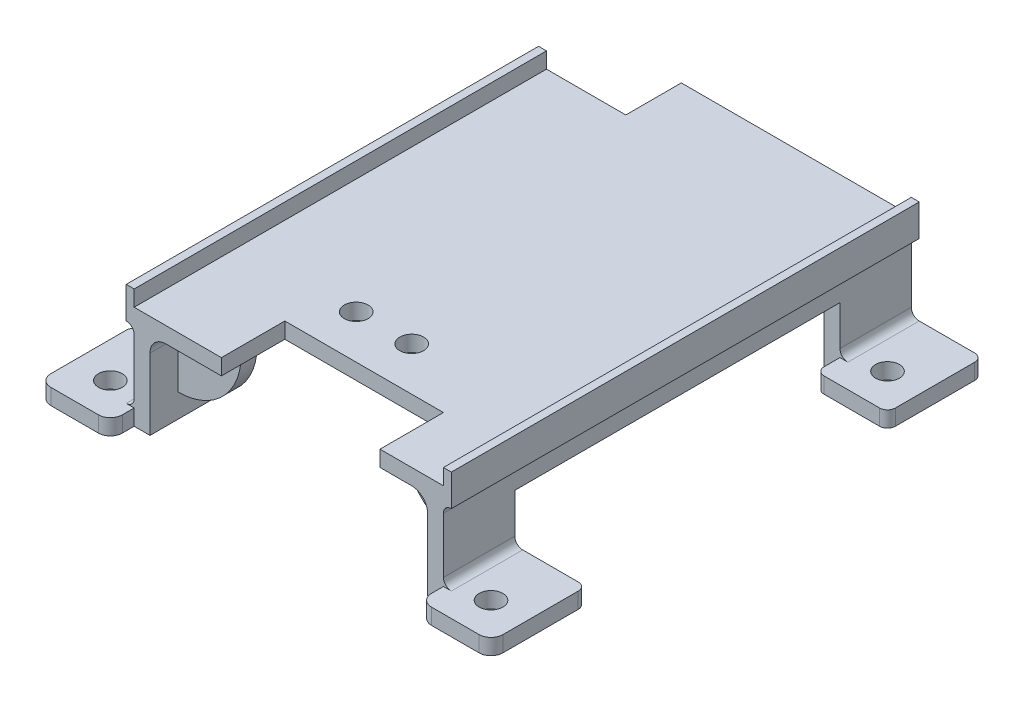
from build123d import *

# Parameters (mm, degrees)
SKETCH1_W           = 57
SKETCH1_H           = 59
BOSS_EXTRUDE1_DEPTH = 13
SKETCH2_W           = 41
SKETCH2_H           = 13
CUT_EXTRUDE1_DEPTH  = 9
SKETCH4_W           = 10
SKETCH4_H           = 7
CUT_EXTRUDE3_DEPTH  = 84.060219118
SKETCH5_W           = 34
SKETCH5_H           = 13
CUT_EXTRUDE4_DEPTH  = 9
SKETCH8_W           = 20
SKETCH8_H           = 13
CUT_EXTRUDE5_DEPTH  = 8
SKETCH9_W           = 35
SKETCH9_H           = 59
CUT_EXTRUDE6_DEPTH  = 11
SKETCH10_W          = 9
SKETCH10_H          = 7
CUT_EXTRUDE7_DEPTH  = 84.060219118
SKETCH11_W          = 9
SKETCH11_H          = 9
CUT_EXTRUDE8_DEPTH  = 11
SKETCH12_W          = 9
SKETCH12_H          = 9
CUT_EXTRUDE9_DEPTH  = 11
SKETCH13_W          = 9
SKETCH13_H          = 9
CUT_EXTRUDE10_DEPTH = 11
SKETCH14_W          = 9
SKETCH14_H          = 9
CUT_EXTRUDE11_DEPTH = 11
SKETCH15_W          = 2
SKETCH15_H          = 41
CUT_EXTRUDE12_DEPTH = 8
SKETCH16_W          = 2
SKETCH16_H          = 34
CUT_EXTRUDE13_DEPTH = 8
SKETCH31_W          = 2
SKETCH31_H          = 8
REVOLVE3_ANGLE      = 90
SKETCH32_W          = 2
SKETCH32_H          = 8
REVOLVE4_ANGLE      = 90
SKETCH33_W          = 6
SKETCH33_H          = 2
REVOLVE5_ANGLE      = 90
SKETCH34_W          = 2
SKETCH34_H          = 8
REVOLVE6_ANGLE      = 90
SKETCH42_R          = 1.5
CUT_EXTRUDE15_DEPTH = 84.060219118
SKETCH46_W          = 59
SKETCH46_H          = 2
BOSS_EXTRUDE3_DEPTH = 1
SKETCH47_W          = 1
SKETCH47_H          = 59
BOSS_EXTRUDE4_DEPTH = 2
SKETCH48_W          = 52
SKETCH48_H          = 2
BOSS_EXTRUDE5_DEPTH = 1
SKETCH49_W          = 1
SKETCH49_H          = 52
BOSS_EXTRUDE6_DEPTH = 2
SKETCH50_W          = 9
SKETCH50_H          = 2
BOSS_EXTRUDE7_DEPTH = 3
SKETCH51_W          = 9
SKETCH51_H          = 2
BOSS_EXTRUDE8_DEPTH = 3
SKETCH52_W          = 9
SKETCH52_H          = 2
BOSS_EXTRUDE9_DEPTH = 3
SKETCH53_R          = 1.5
CUT_EXTRUDE16_DEPTH = 84.060219118
FILLET2_R           = 1.5
FILLET3_R           = 1
FILLET6_START       = -1
FILLET6_DEPTH       = 9
FILLET7_START       = -9
FILLET7_DEPTH       = 9
FILLET7_START_2     = -59
FILLET7_2_DEPTH     = 9
FILLET7_START_3     = -52
FILLET7_3_DEPTH     = 9
FILLET8_START       = -52
FILLET8_DEPTH       = 52
FILLET8_START_2     = -59
FILLET8_2_DEPTH     = 7


with BuildPart() as part:
    # Sketch1 → Boss-Extrude1 (new body)
    with BuildSketch(Plane(origin=(0, 0, 0), x_dir=(1, 0, 0), z_dir=(0, 1, 0))):
        with Locations((28.5, 29.5)):
            Rectangle(SKETCH1_W, SKETCH1_H)
    extrude(amount=BOSS_EXTRUDE1_DEPTH)

    # Sketch2 → Cut-Extrude1 (cut)
    with BuildSketch(Plane(origin=(57, 0, 0), x_dir=(0, 0, -1), z_dir=(1, 0, 0))):
        with Locations((29.5, 6.5)):
            Rectangle(SKETCH2_W, SKETCH2_H)
    extrude(amount=-CUT_EXTRUDE1_DEPTH, mode=Mode.SUBTRACT)

    # Sketch4 → Cut-Extrude3 (cut, through all)
    with BuildSketch(Plane(origin=(0, 13, 0), x_dir=(1, 0, 0), z_dir=(0, 1, 0))):
        with Locations((5, 55.5)):
            Rectangle(SKETCH4_W, SKETCH4_H)
    extrude(amount=-CUT_EXTRUDE3_DEPTH, mode=Mode.SUBTRACT)

    # Sketch5 → Cut-Extrude4 (cut)
    with BuildSketch(Plane.ZY):
        with Locations((-26, 6.5)):
            Rectangle(SKETCH5_W, SKETCH5_H)
    extrude(amount=-CUT_EXTRUDE4_DEPTH, mode=Mode.SUBTRACT)

    # Sketch8 → Cut-Extrude5 (cut)
    with BuildSketch(Plane.XY):
        with Locations((30, 6.5)):
            Rectangle(SKETCH8_W, SKETCH8_H)
    extrude(amount=-CUT_EXTRUDE5_DEPTH, mode=Mode.SUBTRACT)

    # Sketch9 → Cut-Extrude6 (cut)
    with BuildSketch(Plane(origin=(0, 0, 0), x_dir=(-1, 0, 0), z_dir=(0, -1, 0))):
        with Locations((-28.5, 29.5)):
            Rectangle(SKETCH9_W, SKETCH9_H)
    extrude(amount=-CUT_EXTRUDE6_DEPTH, mode=Mode.SUBTRACT)

    # Sketch10 → Cut-Extrude7 (cut, through all)
    with BuildSketch(Plane(origin=(0, 13, 0), x_dir=(1, 0, 0), z_dir=(0, 1, 0))):
        with Locations((14.5, 55.5)):
            Rectangle(SKETCH10_W, SKETCH10_H)
    extrude(amount=-CUT_EXTRUDE7_DEPTH, mode=Mode.SUBTRACT)

    # Sketch11 → Cut-Extrude8 (cut)
    with BuildSketch(Plane(origin=(0, 13, 0), x_dir=(1, 0, 0), z_dir=(0, 1, 0))):
        with Locations((52.5, 4.5)):
            Rectangle(SKETCH11_W, SKETCH11_H)
    extrude(amount=-CUT_EXTRUDE8_DEPTH, mode=Mode.SUBTRACT)

    # Sketch12 → Cut-Extrude9 (cut)
    with BuildSketch(Plane(origin=(0, 13, 0), x_dir=(1, 0, 0), z_dir=(0, 1, 0))):
        with Locations((52.5, 54.5)):
            Rectangle(SKETCH12_W, SKETCH12_H)
    extrude(amount=-CUT_EXTRUDE9_DEPTH, mode=Mode.SUBTRACT)

    # Sketch13 → Cut-Extrude10 (cut)
    with BuildSketch(Plane(origin=(0, 13, 0), x_dir=(1, 0, 0), z_dir=(0, 1, 0))):
        with Locations((4.5, 47.5)):
            Rectangle(SKETCH13_W, SKETCH13_H)
    extrude(amount=-CUT_EXTRUDE10_DEPTH, mode=Mode.SUBTRACT)

    # Sketch14 → Cut-Extrude11 (cut)
    with BuildSketch(Plane(origin=(0, 13, 0), x_dir=(1, 0, 0), z_dir=(0, 1, 0))):
        with Locations((4.5, 4.5)):
            Rectangle(SKETCH14_W, SKETCH14_H)
    extrude(amount=-CUT_EXTRUDE11_DEPTH, mode=Mode.SUBTRACT)

    # Sketch15 → Cut-Extrude12 (cut)
    with BuildSketch(Plane(origin=(0, 0, 0), x_dir=(-1, 0, 0), z_dir=(0, -1, 0))):
        with Locations((-47, 29.5)):
            Rectangle(SKETCH15_W, SKETCH15_H)
    extrude(amount=-CUT_EXTRUDE12_DEPTH, mode=Mode.SUBTRACT)

    # Sketch16 → Cut-Extrude13 (cut)
    with BuildSketch(Plane(origin=(0, 0, 0), x_dir=(-1, 0, 0), z_dir=(0, -1, 0))):
        with Locations((-10, 26)):
            Rectangle(SKETCH16_W, SKETCH16_H)
    extrude(amount=-CUT_EXTRUDE13_DEPTH, mode=Mode.SUBTRACT)

    # Sketch31 → Revolve3 (revolve)
    with BuildSketch(Plane(origin=(11, 0, 0), x_dir=(0, 0, -1), z_dir=(1, 0, 0))):
        with Locations((4.5, 7)):
            Rectangle(SKETCH31_W, SKETCH31_H)
    revolve(axis=Axis((11, 11, -3.5), (0, 0, 1)), revolution_arc=REVOLVE3_ANGLE)

    # Sketch32 → Revolve4 (revolve)
    with BuildSketch(Plane(origin=(11, 0, 0), x_dir=(0, 0, -1), z_dir=(1, 0, 0))):
        with Locations((47.5, 7)):
            Rectangle(SKETCH32_W, SKETCH32_H)
    revolve(axis=Axis((11, 11, -46.5), (0, 0, 1)), revolution_arc=REVOLVE4_ANGLE)

    # Sketch33 → Revolve5 (revolve)
    with BuildSketch(Plane.XZ.offset(-11)):
        with Locations((43, -4.5)):
            Rectangle(SKETCH33_W, SKETCH33_H)
    revolve(axis=Axis((46, 11, -3.5), (0, 0, 1)), revolution_arc=REVOLVE5_ANGLE)

    # Sketch34 → Revolve6 (revolve)
    with BuildSketch(Plane.ZY.offset(-46)):
        with Locations((-54.5, 7)):
            Rectangle(SKETCH34_W, SKETCH34_H)
    revolve(axis=Axis((46, 11, -53.5), (0, 0, -1)), revolution_arc=REVOLVE6_ANGLE)

    # Sketch42 → Cut-Extrude15 (cut, through all)
    with BuildSketch(Plane(origin=(0, 13, 0), x_dir=(1, 0, 0), z_dir=(0, 1, 0))):
        with Locations(Location((23.5, 13.5, 0), (0, 0, 270))):
            Circle(SKETCH42_R)
        with Locations(Location((30.5, 13.5, 0), (0, 0, 270))):
            Circle(SKETCH42_R)
    extrude(amount=-CUT_EXTRUDE15_DEPTH, mode=Mode.SUBTRACT)

    # Sketch46 → Boss-Extrude3 (add)
    with BuildSketch(Plane(origin=(48, 0, 0), x_dir=(0, 0, -1), z_dir=(1, 0, 0))):
        with Locations((29.5, 12)):
            Rectangle(SKETCH46_W, SKETCH46_H)
    extrude(amount=BOSS_EXTRUDE3_DEPTH)

    # Sketch47 → Boss-Extrude4 (add)
    with BuildSketch(Plane(origin=(0, 13, 0), x_dir=(1, 0, 0), z_dir=(0, 1, 0))):
        with Locations((48.5, 29.5)):
            Rectangle(SKETCH47_W, SKETCH47_H)
    extrude(amount=BOSS_EXTRUDE4_DEPTH)

    # Sketch48 → Boss-Extrude5 (add)
    with BuildSketch(Plane.ZY.offset(-9)):
        with Locations((-26, 12)):
            Rectangle(SKETCH48_W, SKETCH48_H)
    extrude(amount=BOSS_EXTRUDE5_DEPTH)

    # Sketch49 → Boss-Extrude6 (add)
    with BuildSketch(Plane(origin=(0, 13, 0), x_dir=(1, 0, 0), z_dir=(0, 1, 0))):
        with Locations((8.5, 26)):
            Rectangle(SKETCH49_W, SKETCH49_H)
    extrude(amount=BOSS_EXTRUDE6_DEPTH)

    # Sketch50 → Boss-Extrude7 (add)
    with BuildSketch(Plane.XY):
        with Locations((4.5, 1)):
            Rectangle(SKETCH50_W, SKETCH50_H)
        with Locations((52.5, 1)):
            Rectangle(SKETCH50_W, SKETCH50_H)
    extrude(amount=BOSS_EXTRUDE7_DEPTH)

    # Sketch51 → Boss-Extrude8 (add)
    with BuildSketch(Plane.XY.offset(-43)):
        with Locations((4.5, 1)):
            Rectangle(SKETCH51_W, SKETCH51_H)
    extrude(amount=BOSS_EXTRUDE8_DEPTH)

    # Sketch52 → Boss-Extrude9 (add)
    with BuildSketch(Plane.XY.offset(-50)):
        with Locations((52.5, 1)):
            Rectangle(SKETCH52_W, SKETCH52_H)
    extrude(amount=BOSS_EXTRUDE9_DEPTH)

    # Sketch53 → Cut-Extrude16 (cut, through all)
    with BuildSketch(Plane(origin=(0, 2, 0), x_dir=(1, 0, 0), z_dir=(0, 1, 0))):
        with Locations(Location((4.5, 44.5, 0), (0, 0, 270))):
            Circle(SKETCH53_R)
        with Locations(Location((52.5, 51.5, 0), (0, 0, 270))):
            Circle(SKETCH53_R)
        with Locations(Location((52.5, 1.5, 0), (0, 0, 270))):
            Circle(SKETCH53_R)
        with Locations(Location((4.5, 1.5, 0), (0, 0, 270))):
            Circle(SKETCH53_R)
    extrude(amount=-CUT_EXTRUDE16_DEPTH, mode=Mode.SUBTRACT)

    # Fillet2
    fillet2_edges = [part.edges().sort_by_distance(p)[0] for p in [
        (0, 1, 3),
        (9, 1, 3),
        (48, 1, 3),
        (57, 1, 3),
    ]]
    fillet(fillet2_edges, radius=FILLET2_R)

    # Fillet3
    fillet3_edges = [part.edges().sort_by_distance(p)[0] for p in [
        (48, 11, -29.5),
        (9, 11, -26),
    ]]
    fillet(fillet3_edges, radius=FILLET3_R - 0.0001)  # a hair under: the kernel refuses the full size

    # Fillet6: read off the stored shape, not the designer's step
    # Fillet6 outline → Fillet6 (cut)
    with BuildSketch(Plane(origin=(0, 0, 0), x_dir=(1, 0, 0), z_dir=(0, 1, 0)).offset(FILLET6_START)):
        with BuildLine():
            add(Edge.make_bspline(
                [(1, 9), (0, 9), (0, 8)],
                knots=[0, 0, 0, 1, 1, 1], degree=2, weights=[1, 0.707106781, 1]))
            Line((1, 9), (0, 9))
            Line((0, 9), (0, 8))
        make_face()
        with BuildLine():
            Line((8, 40), (9, 40))
            Line((9, 40), (9, 41))
            add(Edge.make_bspline(
                [(8, 40), (9, 40), (9, 41)],
                knots=[0, 0, 0, 1, 1, 1], degree=2, weights=[1, 0.707106781, 1]))
        make_face()
        with BuildLine():
            Line((0, 40), (1, 40))
            add(Edge.make_bspline(
                [(1, 40), (0, 40), (0, 41)],
                knots=[0, 0, 0, 1, 1, 1], degree=2, weights=[1, 0.707106781, 1]))
            Line((0, 41), (0, 40))
        make_face()
        with BuildLine():
            add(Edge.make_bspline(
                [(1, 52), (0, 52), (0, 51)],
                knots=[0, 0, 0, 1, 1, 1], degree=2, weights=[1, 0.707106781, 1]))
            Line((1, 52), (0, 52))
            Line((0, 52), (0, 51))
        make_face()
        with BuildLine():
            Line((57, 9), (56, 9))
            add(Edge.make_bspline(
                [(56, 9), (57, 9), (57, 8)],
                knots=[0, 0, 0, 1, 1, 1], degree=2, weights=[1, 0.707106781, 1]))
            Line((57, 8), (57, 9))
        make_face()
        with BuildLine():
            Line((48, 47), (49, 47))
            add(Edge.make_bspline(
                [(49, 47), (48, 47), (48, 48)],
                knots=[0, 0, 0, 1, 1, 1], degree=2, weights=[1, 0.707106781, 1]))
            Line((48, 48), (48, 47))
        make_face()
        with BuildLine():
            add(Edge.make_bspline(
                [(56, 59), (57, 59), (57, 58)],
                knots=[0, 0, 0, 1, 1, 1], degree=2, weights=[1, 0.707106781, 1]))
            Line((57, 58), (57, 59))
            Line((57, 59), (56, 59))
        make_face()
        with BuildLine():
            add(Edge.make_bspline(
                [(56, 47), (57, 47), (57, 48)],
                knots=[0, 0, 0, 1, 1, 1], degree=2, weights=[1, 0.707106781, 1]))
            Line((56, 47), (57, 47))
            Line((57, 47), (57, 48))
        make_face()
    extrude(amount=FILLET6_DEPTH, mode=Mode.SUBTRACT)

    # Fillet7: read off the stored shape, not the designer's step
    # Fillet7 outline → Fillet7 (add)
    with BuildSketch(Plane.XY.offset(FILLET7_START)):
        with BuildLine():
            add(Edge.make_bspline(
                [(8, 2), (9, 2), (9, 3)],
                knots=[0, 0, 0, 1, 1, 1], degree=2, weights=[1, 0.707106781, 1]))
            Line((8, 2), (9, 2))
            Line((9, 2), (9, 3))
        make_face()
        with BuildLine():
            Line((48, 2), (49, 2))
            add(Edge.make_bspline(
                [(49, 2), (48, 2), (48, 3)],
                knots=[0, 0, 0, 1, 1, 1], degree=2, weights=[1, 0.707106781, 1]))
            Line((48, 3), (48, 2))
        make_face()
    extrude(amount=FILLET7_DEPTH)

    # Fillet7 2 outline → Fillet7 2 (add)
    with BuildSketch(Plane.XY.offset(FILLET7_START_2)):
        with BuildLine():
            Line((48, 2), (49, 2))
            add(Edge.make_bspline(
                [(49, 2), (48, 2), (48, 3)],
                knots=[0, 0, 0, 1, 1, 1], degree=2, weights=[1, 0.707106781, 1]))
            Line((48, 3), (48, 2))
        make_face()
    extrude(amount=FILLET7_2_DEPTH)

    # Fillet7 3 outline → Fillet7 3 (add)
    with BuildSketch(Plane.XY.offset(FILLET7_START_3)):
        with BuildLine():
            add(Edge.make_bspline(
                [(8, 2), (9, 2), (9, 3)],
                knots=[0, 0, 0, 1, 1, 1], degree=2, weights=[1, 0.707106781, 1]))
            Line((8, 2), (9, 2))
            Line((9, 2), (9, 3))
        make_face()
    extrude(amount=FILLET7_3_DEPTH)

    # Fillet8: read off the stored shape, not the designer's step
    # Fillet8 outline → Fillet8 (add)
    with BuildSketch(Plane.XY.offset(FILLET8_START)):
        with BuildLine():
            Line((46, 11), (44, 11))
            add(Edge.make_bspline(
                [(44, 11), (46, 11), (46, 9)],
                knots=[0, 0, 0, 1, 1, 1], degree=2, weights=[1, 0.707106781, 1]))
            Line((46, 9), (46, 11))
        make_face()
        with BuildLine():
            add(Edge.make_bspline(
                [(13, 11), (11, 11), (11, 9)],
                knots=[0, 0, 0, 1, 1, 1], degree=2, weights=[1, 0.707106781, 1]))
            Line((13, 11), (11, 11))
            Line((11, 11), (11, 9))
        make_face()
    extrude(amount=FILLET8_DEPTH)

    # Fillet8 2 outline → Fillet8 2 (add)
    with BuildSketch(Plane.XY.offset(FILLET8_START_2)):
        with BuildLine():
            Line((46, 11), (44, 11))
            add(Edge.make_bspline(
                [(44, 11), (46, 11), (46, 9)],
                knots=[0, 0, 0, 1, 1, 1], degree=2, weights=[1, 0.707106781, 1]))
            Line((46, 9), (46, 11))
        make_face()
    extrude(amount=FILLET8_2_DEPTH)


solid = part.part
